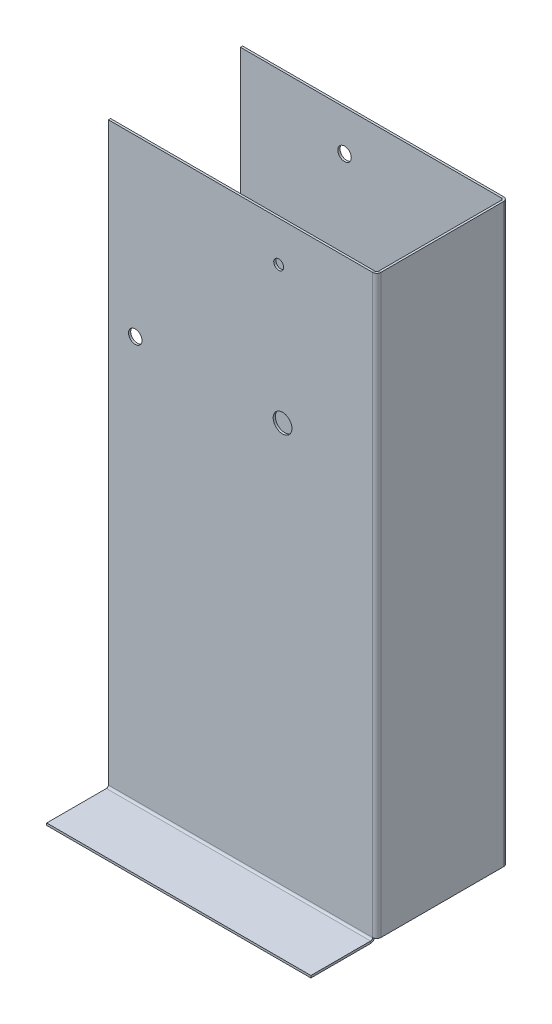
from build123d import *

# Parameters (mm, degrees)
SKETCH1_W                    = 100
SKETCH1_H                    = 214.69
BASE_FLANGE1_DEPTH           = 0.81
EDGE_FLANGE1_STRIP_W         = 4.7132
EDGE_FLANGE1_STRIP_H         = 0.81
EDGE_FLANGE1_STRIP_CUT_DEPTH = 214.69
EDGE_FLANGE1_DEPTH           = 214.69
EDGE_FLANGE2_STRIP_W         = 4.7132
EDGE_FLANGE2_STRIP_H         = 0.81
EDGE_FLANGE2_STRIP_CUT_DEPTH = 214.69
EDGE_FLANGE2_DEPTH           = 214.69
EDGE_FLANGE3_DEPTH           = 98.4534
EDGE_FLANGE3_BEND_DEPTH      = 97.2634
SKETCH18_W                   = 29
SKETCH18_H                   = 1.5466
SKETCH18_W_2                 = 27
CUT_EXTRUDE1_DEPTH           = 23.81
CUT_EXTRUDE2_REACH           = 249.484
SKETCH19_R                   = 2.5
SKETCH19_R_2                 = 3.5
SKETCH19_R_3                 = 1.5
SKETCH19_R_4                 = 3.25
CUT_EXTRUDE3_REACH           = 249.484
SKETCH20_R                   = 1.85
SKETCH20_R_2                 = 2.5
SKETCH20_R_3                 = 3.5


# Sheet-metal steps are written as plain solids
with BuildPart() as part:
    # Sketch1 → Base-Flange1 (new body)
    with BuildSketch(Plane.XY):
        with Locations((50, 107.345)):
            Rectangle(SKETCH1_W, SKETCH1_H)
    extrude(amount=-BASE_FLANGE1_DEPTH)

    # Edge-Flange1 strip (across the edge) → Edge-Flange1 strip cut (cut)
    with BuildSketch(Plane(origin=(100, 214.69, -0.81), x_dir=(-1, 0, 0), z_dir=(0, -1, 0))):
        with Locations((-0.81, -0.405)):
            Rectangle(EDGE_FLANGE1_STRIP_W, EDGE_FLANGE1_STRIP_H)
    extrude(amount=EDGE_FLANGE1_STRIP_CUT_DEPTH, mode=Mode.SUBTRACT)

    # Edge-Flange1 section (across the edge) → Edge-Flange1 (add)
    with BuildSketch(Plane(origin=(100, 214.69, -0.81), x_dir=(-1, 0, 0), z_dir=(0, -1, 0))):
        with BuildLine():
            Line((0, 0.7366), (0, 48))
            Line((0, 48), (0.81, 48))
            Line((0.81, 48), (0.81, 0.7366))
            ThreePointArc((0.81, 0.7366), (1.025745145, 0.215745145), (1.5466, 0))
            Line((1.5466, 0), (1.5466, -0.81))
            ThreePointArc((1.5466, -0.81), (0.452988652, -0.357011348), (0, 0.7366))
        make_face()
    extrude(amount=EDGE_FLANGE1_DEPTH)

    # Edge-Flange2 strip (across the edge) → Edge-Flange2 strip cut (cut)
    with BuildSketch(Plane(origin=(99.19, 214.69, -48.81), x_dir=(0, 0, 1), z_dir=(0, -1, 0))):
        with Locations((-0.81, -0.405)):
            Rectangle(EDGE_FLANGE2_STRIP_W, EDGE_FLANGE2_STRIP_H)
    extrude(amount=EDGE_FLANGE2_STRIP_CUT_DEPTH, mode=Mode.SUBTRACT)

    # Edge-Flange2 section (across the edge) → Edge-Flange2 (add)
    with BuildSketch(Plane(origin=(99.19, 214.69, -48.81), x_dir=(0, 0, 1), z_dir=(0, -1, 0))):
        with BuildLine():
            Line((0, 0.7366), (0, 98))
            Line((0, 98), (0.81, 98))
            Line((0.81, 98), (0.81, 0.7366))
            ThreePointArc((0.81, 0.7366), (1.025745145, 0.215745145), (1.5466, 0))
            Line((1.5466, 0), (1.5466, -0.81))
            ThreePointArc((1.5466, -0.81), (0.452988652, -0.357011348), (0, 0.7366))
        make_face()
    extrude(amount=EDGE_FLANGE2_DEPTH)

    # Edge-Flange3 section (across the edge) → Edge-Flange3 (add)
    with BuildSketch(Plane(origin=(0, -0.7366, 0), x_dir=(0, 1, 0), z_dir=(1, 0, 0))):
        with BuildLine():
            Line((-0.81, 0.7366), (-0.81, 23))
            Line((-0.81, 23), (0, 23))
            Line((0, 23), (0, 0.7366))
            ThreePointArc((0, 0.7366), (0.215745145, 0.215745145), (0.7366, 0))
            Line((0.7366, 0), (0.7366, -0.81))
            ThreePointArc((0.7366, -0.81), (-0.357011348, -0.357011348), (-0.81, 0.7366))
        make_face()
    extrude(amount=EDGE_FLANGE3_DEPTH)

    # Edge-Flange3 section 2 (across the edge) → Edge-Flange3 bend (add)
    with BuildSketch(Plane(origin=(98.4534, -0.7366, -48.81), x_dir=(0, 1, 0), z_dir=(-1, 0, 0))):
        with BuildLine():
            Line((-0.81, 0.7366), (-0.81, 23))
            Line((-0.81, 23), (0, 23))
            Line((0, 23), (0, 0.7366))
            ThreePointArc((0, 0.7366), (0.215745145, 0.215745145), (0.7366, 0))
            Line((0.7366, 0), (0.7366, -0.81))
            ThreePointArc((0.7366, -0.81), (-0.357011348, -0.357011348), (-0.81, 0.7366))
        make_face()
    extrude(amount=EDGE_FLANGE3_BEND_DEPTH)

    # Sketch18 → Cut-Extrude1 (cut)
    with BuildSketch(Plane(origin=(0, -57.7366, -71.81), x_dir=(1, 0, 0), z_dir=(0, 0, 1))):
        with Locations((83.9534, 56.9633)):
            Rectangle(SKETCH18_W, SKETCH18_H)
        with Locations((14.69, 56.9633)):
            Rectangle(SKETCH18_W_2, SKETCH18_H)
    extrude(amount=CUT_EXTRUDE1_DEPTH, mode=Mode.SUBTRACT)

    # Sketch19 → Cut-Extrude2 (cut, up to next)
    with BuildSketch(Plane.XY.offset(-48.81), mode=Mode.PRIVATE) as cut_extrude2_sk1:
        with Locations((40, 199.69)):
            Circle(SKETCH19_R)
    cut_extrude2_tool1 = extrude(cut_extrude2_sk1.sketch, amount=CUT_EXTRUDE2_REACH, mode=Mode.PRIVATE) & part.part
    # Sketch19 → Cut-Extrude2 (cut, up to next)
    with BuildSketch(Plane.XY.offset(-48.81), mode=Mode.PRIVATE) as cut_extrude2_sk2:
        with Locations((10, 149.69)):
            Circle(SKETCH19_R)
    cut_extrude2_tool2 = extrude(cut_extrude2_sk2.sketch, amount=CUT_EXTRUDE2_REACH, mode=Mode.PRIVATE) & part.part
    # Sketch19 → Cut-Extrude2 (cut, up to next)
    with BuildSketch(Plane.XY.offset(-48.81), mode=Mode.PRIVATE) as cut_extrude2_sk3:
        with Locations((64.901247632, 149.252126171)):
            Circle(SKETCH19_R_2)
    cut_extrude2_tool3 = extrude(cut_extrude2_sk3.sketch, amount=CUT_EXTRUDE2_REACH, mode=Mode.PRIVATE) & part.part
    # Sketch19 → Cut-Extrude2 (cut, up to next)
    with BuildSketch(Plane.XY.offset(-48.81), mode=Mode.PRIVATE) as cut_extrude2_sk4:
        with Locations((64.901247632, 171.426326171)):
            Circle(SKETCH19_R_3)
    cut_extrude2_tool4 = extrude(cut_extrude2_sk4.sketch, amount=CUT_EXTRUDE2_REACH, mode=Mode.PRIVATE) & part.part
    # Sketch19 → Cut-Extrude2 (cut, up to next)
    with BuildSketch(Plane.XY.offset(-48.81), mode=Mode.PRIVATE) as cut_extrude2_sk5:
        with Locations((75.112047632, 149.252126171)):
            Circle(SKETCH19_R_3)
    cut_extrude2_tool5 = extrude(cut_extrude2_sk5.sketch, amount=CUT_EXTRUDE2_REACH, mode=Mode.PRIVATE) & part.part
    # Sketch19 → Cut-Extrude2 (cut, up to next)
    with BuildSketch(Plane.XY.offset(-48.81), mode=Mode.PRIVATE) as cut_extrude2_sk6:
        with Locations((54.690447632, 149.252126171)):
            Circle(SKETCH19_R_3)
    cut_extrude2_tool6 = extrude(cut_extrude2_sk6.sketch, amount=CUT_EXTRUDE2_REACH, mode=Mode.PRIVATE) & part.part
    # Sketch19 → Cut-Extrude2 (cut, up to next)
    with BuildSketch(Plane.XY.offset(-48.81), mode=Mode.PRIVATE) as cut_extrude2_sk7:
        with Locations((64.901247632, 122.577226171)):
            Circle(SKETCH19_R_4)
    cut_extrude2_tool7 = extrude(cut_extrude2_sk7.sketch, amount=CUT_EXTRUDE2_REACH, mode=Mode.PRIVATE) & part.part
    add(cut_extrude2_tool1.solids().sort_by_distance((40, 199.69, -48.81))[0], mode=Mode.SUBTRACT)
    add(cut_extrude2_tool2.solids().sort_by_distance((10, 149.69, -48.81))[0], mode=Mode.SUBTRACT)
    add(cut_extrude2_tool3.solids().sort_by_distance((64.901248, 149.252126, -48.81))[0], mode=Mode.SUBTRACT)
    add(cut_extrude2_tool4.solids().sort_by_distance((64.901248, 171.426326, -48.81))[0], mode=Mode.SUBTRACT)
    add(cut_extrude2_tool5.solids().sort_by_distance((75.112048, 149.252126, -48.81))[0], mode=Mode.SUBTRACT)
    add(cut_extrude2_tool6.solids().sort_by_distance((54.690448, 149.252126, -48.81))[0], mode=Mode.SUBTRACT)
    add(cut_extrude2_tool7.solids().sort_by_distance((64.901248, 122.577226, -48.81))[0], mode=Mode.SUBTRACT)

    # Sketch20 → Cut-Extrude3 (cut, up to next)
    with BuildSketch(Plane.XY, mode=Mode.PRIVATE) as cut_extrude3_sk1:
        with Locations((63.4534, 199.69)):
            Circle(SKETCH20_R)
    cut_extrude3_tool1 = extrude(cut_extrude3_sk1.sketch, amount=-CUT_EXTRUDE3_REACH, mode=Mode.PRIVATE) & part.part
    # Sketch20 → Cut-Extrude3 (cut, up to next)
    with BuildSketch(Plane.XY, mode=Mode.PRIVATE) as cut_extrude3_sk2:
        with Locations((10, 149.69)):
            Circle(SKETCH20_R_2)
    cut_extrude3_tool2 = extrude(cut_extrude3_sk2.sketch, amount=-CUT_EXTRUDE3_REACH, mode=Mode.PRIVATE) & part.part
    # Sketch20 → Cut-Extrude3 (cut, up to next)
    with BuildSketch(Plane.XY, mode=Mode.PRIVATE) as cut_extrude3_sk3:
        with Locations((64.901247632, 149.252126171)):
            Circle(SKETCH20_R_3)
    cut_extrude3_tool3 = extrude(cut_extrude3_sk3.sketch, amount=-CUT_EXTRUDE3_REACH, mode=Mode.PRIVATE) & part.part
    add(cut_extrude3_tool1.solids().sort_by_distance((63.4534, 199.69, 0))[0], mode=Mode.SUBTRACT)
    add(cut_extrude3_tool2.solids().sort_by_distance((10, 149.69, 0))[0], mode=Mode.SUBTRACT)
    add(cut_extrude3_tool3.solids().sort_by_distance((64.901248, 149.252126, 0))[0], mode=Mode.SUBTRACT)


solid = part.part
